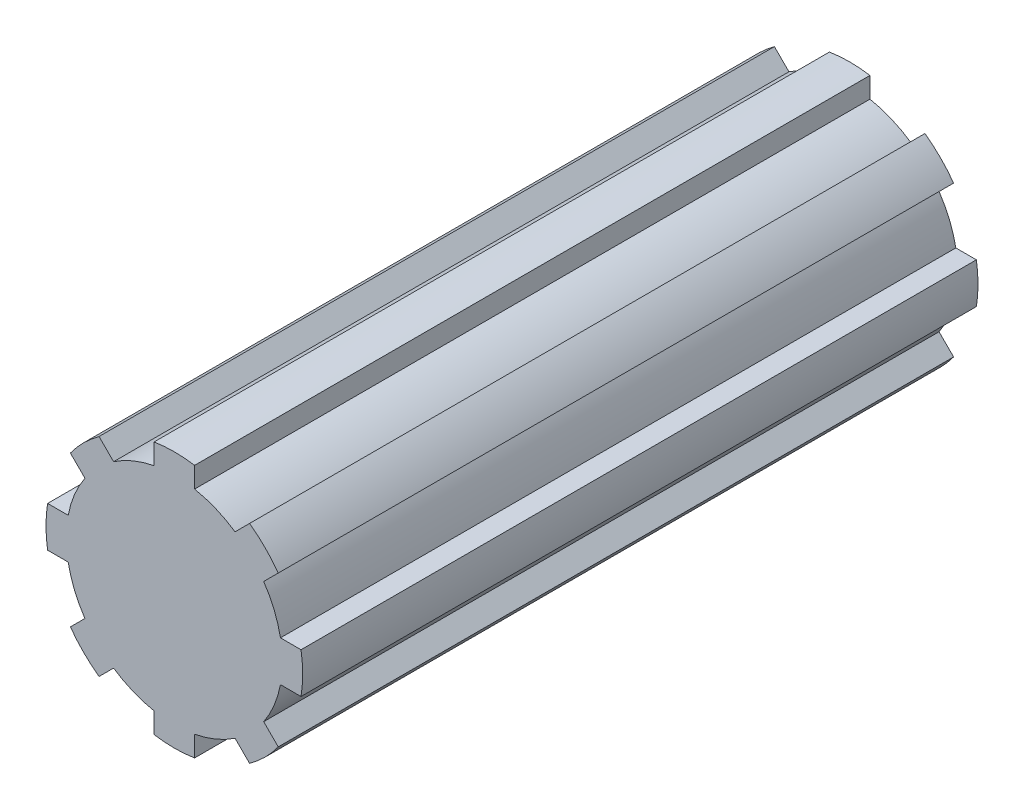
from build123d import *

# Parameters (mm, degrees)
SKETCH1_R          = 16
BASEKEY_DEPTH      = 50
RECTANGLE_DEPTH    = 50
RECTANGLEPAT_COUNT = 8


with BuildPart() as part:
    # Sketch1 → BaseKey (new, symmetric)
    with BuildSketch(Plane.XY):
        Circle(SKETCH1_R)
    extrude(amount=BASEKEY_DEPTH, both=True)

    # Sketch2 → Rectangle (add, symmetric)
    with BuildSketch(Plane.XY):
        with BuildLine():
            Line((-3, 18.761663039), (-3, 0))
            Line((-3, 0), (3, 0))
            Line((3, 0), (3, 18.761663039))
            ThreePointArc((3, 18.761663039), (0, 19), (-3, 18.761663039))
        make_face()
    rectangle = extrude(amount=RECTANGLE_DEPTH, both=True)

    # RectanglePat: Rectangle ×8 about axis
    rectanglepat_axis = Axis((0, 0, 50), (0, 0, -1))
    for i in range(1, RECTANGLEPAT_COUNT):
        add(rectangle.rotate(rectanglepat_axis, i * 360 / RECTANGLEPAT_COUNT))


solid = part.part
